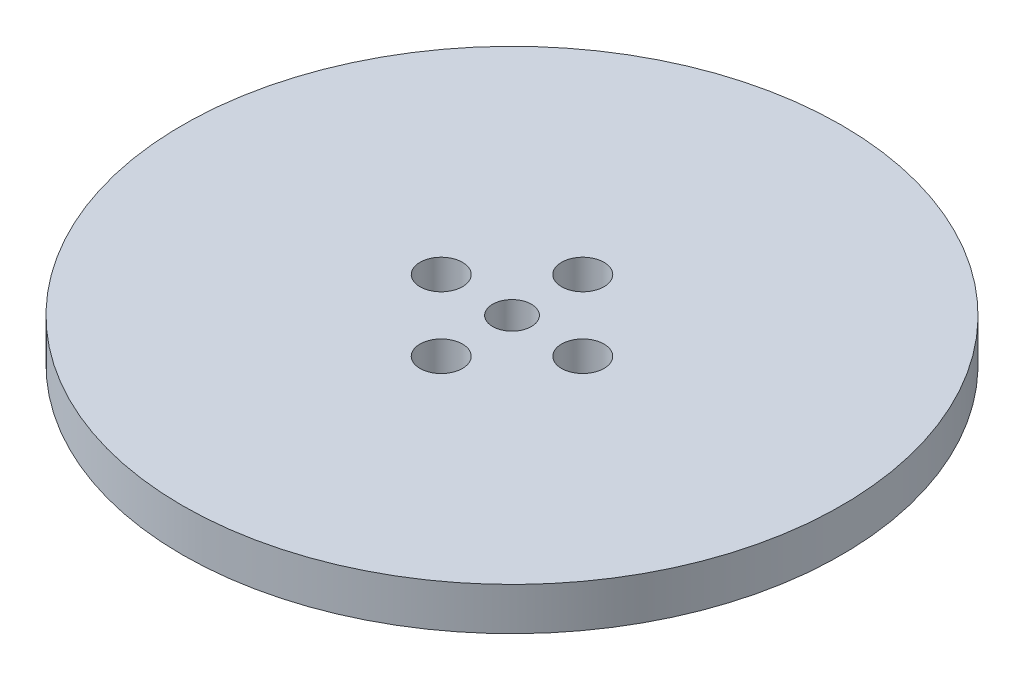
from build123d import *

# Parameters (mm, degrees)
SKETCH1_R           = 85
BOSS_EXTRUDE1_DEPTH = 11
SKETCH2_R           = 5
CUT_EXTRUDE1_DEPTH  = 121.710397232
SKETCH3_R           = 5.472654813
CUT_EXTRUDE2_DEPTH  = 8.461836173
CIRPATTERN1_COUNT   = 4


with BuildPart() as part:
    # Sketch1 → Boss-Extrude1 (new body)
    with BuildSketch(Plane(origin=(0, 0, 0), x_dir=(1, 0, 0), z_dir=(0, 1, 0))):
        Circle(SKETCH1_R)
    extrude(amount=BOSS_EXTRUDE1_DEPTH)

    # Sketch2 → Cut-Extrude1 (cut, through all)
    with BuildSketch(Plane(origin=(0, 0, 0), x_dir=(1, 0, 0), z_dir=(0, 1, 0))):
        Circle(SKETCH2_R)
    extrude(amount=CUT_EXTRUDE1_DEPTH, mode=Mode.SUBTRACT)

    # Sketch3 → Cut-Extrude2 (cut)
    with BuildSketch(Plane(origin=(0, 11, 0), x_dir=(1, 0, 0), z_dir=(0, 1, 0))):
        with Locations((-18.255528813, 0)):
            Circle(SKETCH3_R)
    cut_extrude2 = extrude(amount=-CUT_EXTRUDE2_DEPTH, mode=Mode.SUBTRACT)

    # CirPattern1: Cut-Extrude2 ×4 about axis
    cirpattern1_axis = Axis((0, 0, 0), (0, 1, 0))
    for i in range(1, CIRPATTERN1_COUNT):
        add(cut_extrude2.rotate(cirpattern1_axis, i * 360 / CIRPATTERN1_COUNT), mode=Mode.SUBTRACT)


solid = part.part
